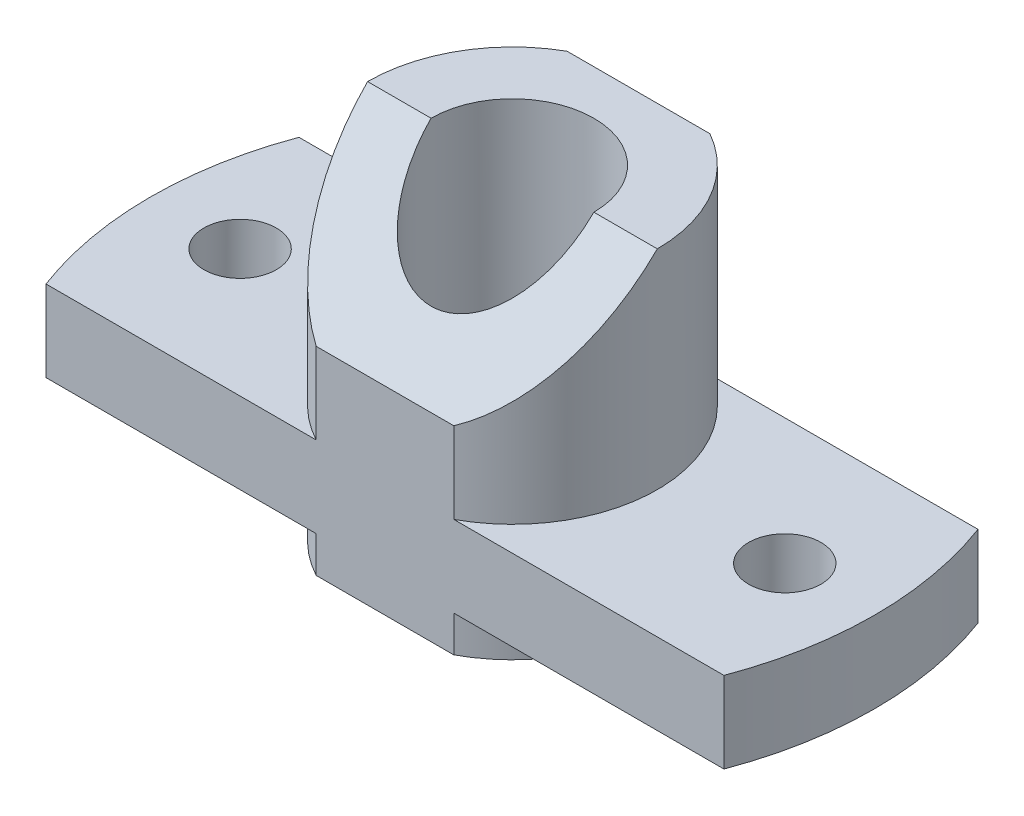
from build123d import *

# Parameters (mm, degrees)
SKETCH3_W                  = 118.872
SKETCH3_H                  = 41.148
CUT_EXTRUDE1_DEPTH         = 107.4453968
SKETCH4_W                  = 119.061805732
SKETCH4_H                  = 41.402
CUT_EXTRUDE2_DEPTH         = 107.4453968
F_1_2_1_124_DOWEL_HOLE1_D  = 28.5496
F_1_2_0_5000_DOWEL_HOLE1_D = 12.7
CHAMFER1_SIZE              = 22.352


with BuildPart() as part:
    # Sketch2 → Revolve1 (revolve)
    with BuildSketch(Plane.XY, mode=Mode.PRIVATE) as revolve1_sk:
        Polygon((-63.5, 20.574), (-63.5, 6.35), (-25.4, 6.35), (-25.4, 0), (0, 0), (0, 57.15), (-25.4, 57.15), (-25.4, 20.574), align=None)
    revolve(revolve1_sk.sketch.rotate(Axis((0, 0, 0), (0, 1, 0)), 180), axis=Axis((0, 0, 0), (0, 1, 0)))

    # Sketch3 → Cut-Extrude1 (cut, through all)
    with BuildSketch(Plane(origin=(0, 57.15, 0), x_dir=(1, 0, 0), z_dir=(0, 1, 0))):
        with Locations((0, -42.926)):
            Rectangle(SKETCH3_W, SKETCH3_H)
    extrude(amount=-CUT_EXTRUDE1_DEPTH, mode=Mode.SUBTRACT)

    # Sketch4 → Cut-Extrude2 (cut, through all)
    with BuildSketch(Plane(origin=(0, 57.15, 0), x_dir=(1, 0, 0), z_dir=(0, 1, 0))):
        with Locations((0, 42.799)):
            Rectangle(SKETCH4_W, SKETCH4_H)
    extrude(amount=-CUT_EXTRUDE2_DEPTH, mode=Mode.SUBTRACT)

    # 1/2 (1.124) Dowel Hole1 (through all)
    with Locations(Plane(origin=(0, 57.15, 0), x_dir=(1, 0, 0), z_dir=(0, 1, 0))):
        with Locations((0, 0)):
            Hole(F_1_2_1_124_DOWEL_HOLE1_D / 2)

    # 1/2 (0.5000) Dowel Hole1 (through all)
    with Locations(Plane(origin=(0, 20.574, 0), x_dir=(1, 0, 0), z_dir=(0, 1, 0))):
        with Locations((-47.752, 0), (47.752, 0)):
            Hole(F_1_2_0_5000_DOWEL_HOLE1_D / 2)

    # Chamfer1
    # the kernel refuses this chamfer: 22.352 mm, written as the material it takes off along each edge
    with BuildSketch(Plane(origin=(-69.546589707, 57.15, 22.352), x_dir=(0, -0.9996219169112968, 0.027495876610586365), z_dir=(1, 0, 0))) as chamfer1_piece_1:
        Polygon((CHAMFER1_SIZE * 0.999621916911, CHAMFER1_SIZE * 0.0274958766106), (-CHAMFER1_SIZE * 0.0274958766106, CHAMFER1_SIZE * 0.999621916911), (0, 0), align=None)
    extrude(amount=139.093179415, mode=Mode.SUBTRACT)


solid = part.part
